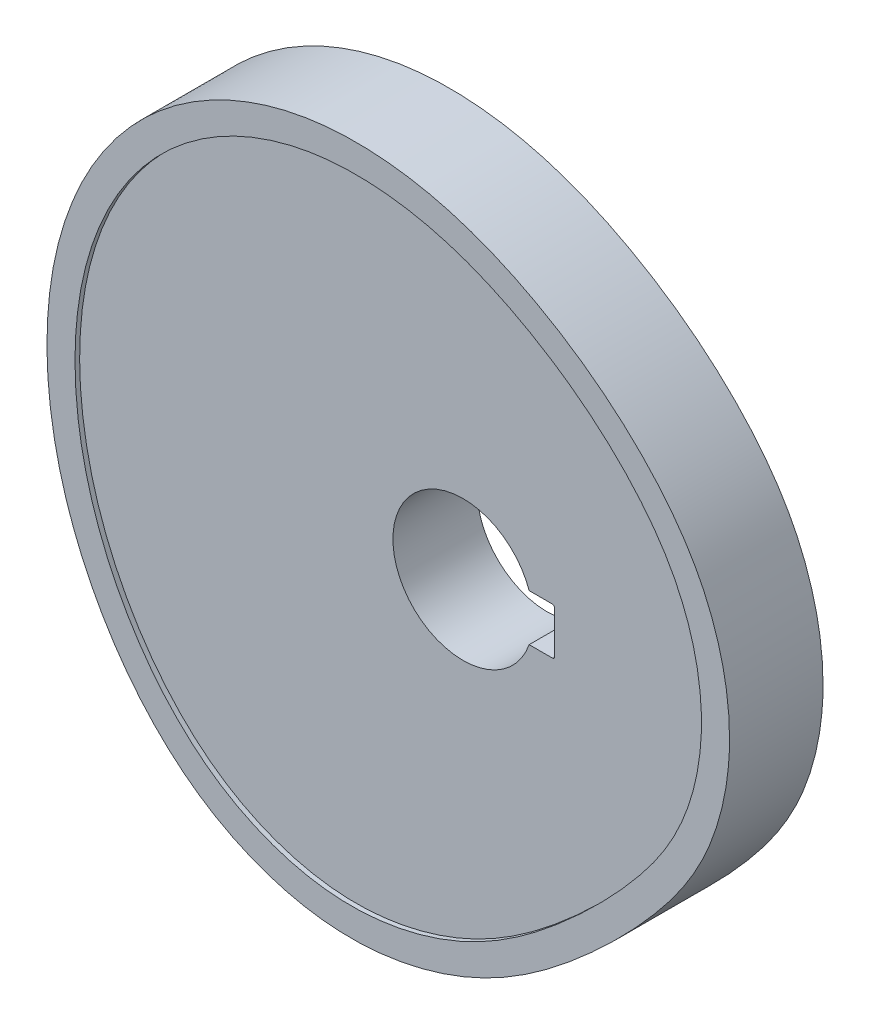
from build123d import *

# Parameters (mm, degrees)
BOSS_EXTRUDE1_DEPTH            = 5
CUT_EXTRUDE2_REACH             = 102.859
SKETCH2_R                      = 7.5
CUT_EXTRUDE2_DIRECTION_2_REACH = 102.859
CUT_EXTRUDE3_REACH             = 102.859
SKETCH3_W                      = 2.728932188
SKETCH3_H                      = 5
CUT_EXTRUDE3_DIRECTION_2_REACH = 102.859
FILLET1_R                      = 0.25
CUT_EXTRUDE4_DEPTH             = 0.5


with BuildPart() as part:
    # Sketch9 → Boss-Extrude1 (new, symmetric)
    with BuildSketch(Plane.XY):
        with BuildLine():
            add(Edge.make_bspline(
                [(-20, 0), (-20.001059559, 2.840295049), (-20.752209017, 7.912811004), (-23.787153894, 14.912871226), (-29.695178727, 22.598243432), (-38.847550396, 29.632408635), (-51.4940462, 35.064234447), (-63.75697987, 35.823939577), (-74.29879056, 32.514125082), (-82.055976802, 27.294052537), (-88.232270819, 19.842989408), (-92.173496152, 10.423465554), (-93.458377119, -0.370018429), (-91.981609804, -11.52441809), (-86.986761413, -23.647717896), (-77.497212816, -34.714128195), (-62.053651378, -40.157282994), (-46.610638195, -36.694902323), (-35.702180078, -28.403732373), (-28.889135417, -21.471550451), (-24.722561948, -16.111794151), (-21.958057767, -11.093814656), (-20.32804374, -5.515695167), (-19.999395023, -1.621723267), (-20, 0)],
                knots=[0, 0, 0, 0, 0.03725769, 0.066321656, 0.099391974, 0.163632008, 0.215601192, 0.278635735, 0.320092284, 0.358808669, 0.399928824, 0.445526896, 0.490998547, 0.541318182, 0.591637817, 0.661938376, 0.725960416, 0.796842176, 0.859784765, 0.90386888, 0.924419882, 0.948824929, 0.978726977, 1, 1, 1, 1], degree=3))
        make_face()
    extrude(amount=BOSS_EXTRUDE1_DEPTH, both=True)

    # Sketch2 → Cut-Extrude2 (cut, up to next)
    with BuildSketch(Plane.XY, mode=Mode.PRIVATE) as cut_extrude2_sk1:
        with Locations((-49, 0)):
            Circle(SKETCH2_R)
    cut_extrude2_tool1 = extrude(cut_extrude2_sk1.sketch, amount=-CUT_EXTRUDE2_REACH, mode=Mode.PRIVATE) & part.part
    add(cut_extrude2_tool1.solids().sort_by_distance((-49, 0, 0))[0], mode=Mode.SUBTRACT)

    # Sketch2 → Cut-Extrude2 direction 2 (cut, up to next)
    with BuildSketch(Plane.XY, mode=Mode.PRIVATE) as cut_extrude2_direction_2_sk1:
        with Locations((-49, 0)):
            Circle(SKETCH2_R)
    cut_extrude2_direction_2_tool1 = extrude(cut_extrude2_direction_2_sk1.sketch, amount=CUT_EXTRUDE2_DIRECTION_2_REACH, mode=Mode.PRIVATE) & part.part
    add(cut_extrude2_direction_2_tool1.solids().sort_by_distance((-49, 0, 0))[0], mode=Mode.SUBTRACT)

    # Sketch3 → Cut-Extrude3 (cut, up to next)
    with BuildSketch(Plane.XY, mode=Mode.PRIVATE) as cut_extrude3_sk1:
        with Locations((-40.564466094, 0)):
            Rectangle(SKETCH3_W, SKETCH3_H)
    cut_extrude3_tool1 = extrude(cut_extrude3_sk1.sketch, amount=-CUT_EXTRUDE3_REACH, mode=Mode.PRIVATE) & part.part
    add(cut_extrude3_tool1.solids().sort_by_distance((-40.564466, 0, 0))[0], mode=Mode.SUBTRACT)

    # Sketch3 → Cut-Extrude3 direction 2 (cut, up to next)
    with BuildSketch(Plane.XY, mode=Mode.PRIVATE) as cut_extrude3_direction_2_sk1:
        with Locations((-40.564466094, 0)):
            Rectangle(SKETCH3_W, SKETCH3_H)
    cut_extrude3_direction_2_tool1 = extrude(cut_extrude3_direction_2_sk1.sketch, amount=CUT_EXTRUDE3_DIRECTION_2_REACH, mode=Mode.PRIVATE) & part.part
    add(cut_extrude3_direction_2_tool1.solids().sort_by_distance((-40.564466, 0, 0))[0], mode=Mode.SUBTRACT)

    # Fillet1
    fillet1_edges = [part.edges().sort_by_distance(p)[0] for p in [
        (-39.2, -2.5, 0),
        (-39.2, 2.5, 0),
    ]]
    fillet(fillet1_edges, radius=FILLET1_R)

    # Sketch10 → Cut-Extrude4 (cut, symmetric)
    with BuildSketch(Plane.XY.offset(5)):
        with BuildLine():
            add(Edge.make_bspline(
                [(-90.000000149, 0.000946837), (-89.999303392, -2.206691613), (-89.820373119, -4.385446683), (-89.125938439, -8.688413782), (-88.610359952, -10.812613805), (-87.2244307, -15.003521733), (-86.371697273, -17.015262026), (-84.357976412, -20.870359017), (-83.200880456, -22.71697918), (-81.53158551, -24.905169948), (-81.185515324, -25.337575905), (-80.476216931, -26.180640071), (-80.112410993, -26.59214745), (-78.992494676, -27.795469723), (-78.20799588, -28.556205278), (-76.555320477, -29.9860668), (-75.687182912, -30.655235509), (-74.313343903, -31.580565887), (-73.842880746, -31.875938706), (-72.892260846, -32.43179016), (-72.410392417, -32.693497596), (-70.94567571, -33.431359772), (-69.943829189, -33.860534251), (-67.889509587, -34.593690116), (-66.837053465, -34.897713437), (-65.217599893, -35.252930861), (-64.671714631, -35.35410191), (-63.583365047, -35.518652256), (-63.038802938, -35.582524507), (-61.403943807, -35.71841668), (-60.312464878, -35.734279542), (-58.673083271, -35.655291064), (-58.126261126, -35.611780108), (-57.031912098, -35.491273297), (-56.482713223, -35.413954143), (-54.849777379, -35.135322575), (-53.779654252, -34.888007692), (-51.673173325, -34.281025277), (-50.636828379, -33.921314971), (-49.106908472, -33.299902362), (-48.600058968, -33.07859937), (-47.599274099, -32.610538225), (-47.107101252, -32.364561186), (-44.683688878, -31.080242928), (-42.8638327, -29.88001556), (-40.251603529, -27.908818255), (-39.400625186, -27.22302617), (-37.729603178, -25.806481098), (-36.907885149, -25.074992871), (-34.492873689, -22.838991862), (-32.951713171, -21.287379205), (-30.765162476, -18.849138604), (-30.055967287, -18.018992566), (-28.689480763, -16.312753808), (-28.03404714, -15.435016592), (-27.121184639, -14.056190005), (-26.827955559, -13.585041675), (-26.273401625, -12.632410341), (-26.011272194, -12.149845941), (-25.271901826, -10.682756688), (-24.842678872, -9.678423231), (-24.297116139, -8.131383544), (-24.13140581, -7.609043885), (-23.832403473, -6.55099121), (-23.698827677, -6.013929186), (-23.349791518, -4.391449016), (-23.187797767, -3.306157575), (-23.001180059, -1.128505786), (-22.976795715, -0.036133108), (-23.04489319, 1.607812322), (-23.084987211, 2.156689254), (-23.200508419, 3.256261325), (-23.275892694, 3.805326937), (-23.735433348, 6.517308446), (-24.367102164, 8.609084197), (-25.492961567, 11.124706716), (-25.735983503, 11.624285902), (-26.250434099, 12.600728241), (-26.522376727, 13.078615756), (-27.380495411, 14.482584159), (-28.007953064, 15.379679506), (-29.353234539, 17.110420327), (-30.072344818, 17.945402314), (-31.58008846, 19.557032107), (-32.362261367, 20.326049569), (-34.786361004, 22.532230262), (-36.50533493, 23.869215744), (-39.2206725, 25.69672516), (-40.148741494, 26.27604667), (-42.049446387, 27.37674323), (-43.0231098, 27.89883071), (-45.970621877, 29.344126417), (-47.98496031, 30.155531985), (-52.132076005, 31.413101778), (-54.265635358, 31.856854191), (-57.567786263, 32.208515615), (-58.667666023, 32.271065399), (-60.858546469, 32.284742414), (-61.950717311, 32.236006495), (-64.128139185, 32.020908654), (-65.213360791, 31.854046499), (-66.835593842, 31.508572865), (-67.375594271, 31.377473295), (-68.439494715, 31.087166984), (-68.965209795, 30.927612533), (-71.563086678, 30.05893595), (-73.543833078, 29.138671804), (-75.894052785, 27.697981818), (-76.359301275, 27.39417039), (-77.267810981, 26.762983234), (-77.711085147, 26.435769254), (-79.008567486, 25.41990308), (-79.830340216, 24.696925812), (-81.3888854, 23.161019043), (-82.125980107, 22.348430568), (-83.168444086, 21.062689136), (-83.506292902, 20.621584166), (-84.154109518, 19.725694936), (-84.46448693, 19.270569373), (-85.95023568, 16.959841458), (-86.928220301, 14.999484489), (-87.908796619, 12.420657759), (-88.0930258, 11.897147243), (-88.43402273, 10.846327416), (-88.591092201, 10.318418883), (-89.023176465, 8.727413789), (-89.259011771, 7.657027433), (-89.633249593, 5.498126229), (-89.771650369, 4.409611058), (-89.90937467, 2.763836908), (-89.943618693, 2.213007966), (-89.989053132, 1.107333725), (-90.000174339, 0.552856449), (-90.000000149, 0.000946837)],
                knots=[0, 0, 0, 0, 0.03125, 0.03125, 0.0625, 0.0625, 0.09375, 0.09375, 0.125, 0.125, 0.1328125, 0.1328125, 0.140625, 0.140625, 0.15625, 0.15625, 0.171875, 0.171875, 0.1796875, 0.1796875, 0.1875, 0.1875, 0.203125, 0.203125, 0.21875, 0.21875, 0.2265625, 0.2265625, 0.234375, 0.234375, 0.25, 0.25, 0.2578125, 0.2578125, 0.265625, 0.265625, 0.28125, 0.28125, 0.296875, 0.296875, 0.3046875, 0.3046875, 0.3125, 0.3125, 0.34375, 0.34375, 0.359375, 0.359375, 0.375, 0.375, 0.40625, 0.40625, 0.421875, 0.421875, 0.4375, 0.4375, 0.4453125, 0.4453125, 0.453125, 0.453125, 0.46875, 0.46875, 0.4765625, 0.4765625, 0.484375, 0.484375, 0.5, 0.5, 0.515625, 0.515625, 0.5234375, 0.5234375, 0.53125, 0.53125, 0.5625, 0.5625, 0.5703125, 0.5703125, 0.578125, 0.578125, 0.59375, 0.59375, 0.609375, 0.609375, 0.625, 0.625, 0.65625, 0.65625, 0.671875, 0.671875, 0.6875, 0.6875, 0.71875, 0.71875, 0.75, 0.75, 0.765625, 0.765625, 0.78125, 0.78125, 0.796875, 0.796875, 0.8046875, 0.8046875, 0.8125, 0.8125, 0.84375, 0.84375, 0.8515625, 0.8515625, 0.859375, 0.859375, 0.875, 0.875, 0.890625, 0.890625, 0.8984375, 0.8984375, 0.90625, 0.90625, 0.9375, 0.9375, 0.9453125, 0.9453125, 0.953125, 0.953125, 0.96875, 0.96875, 0.984375, 0.984375, 0.9921875, 0.9921875, 1, 1, 1, 1], degree=3))
        make_face()
    cut_extrude4 = extrude(amount=CUT_EXTRUDE4_DEPTH, both=True, mode=Mode.SUBTRACT)

    # Mirror1: Cut-Extrude4 across plane
    add(cut_extrude4.mirror(Plane.XY), mode=Mode.SUBTRACT)


solid = part.part
